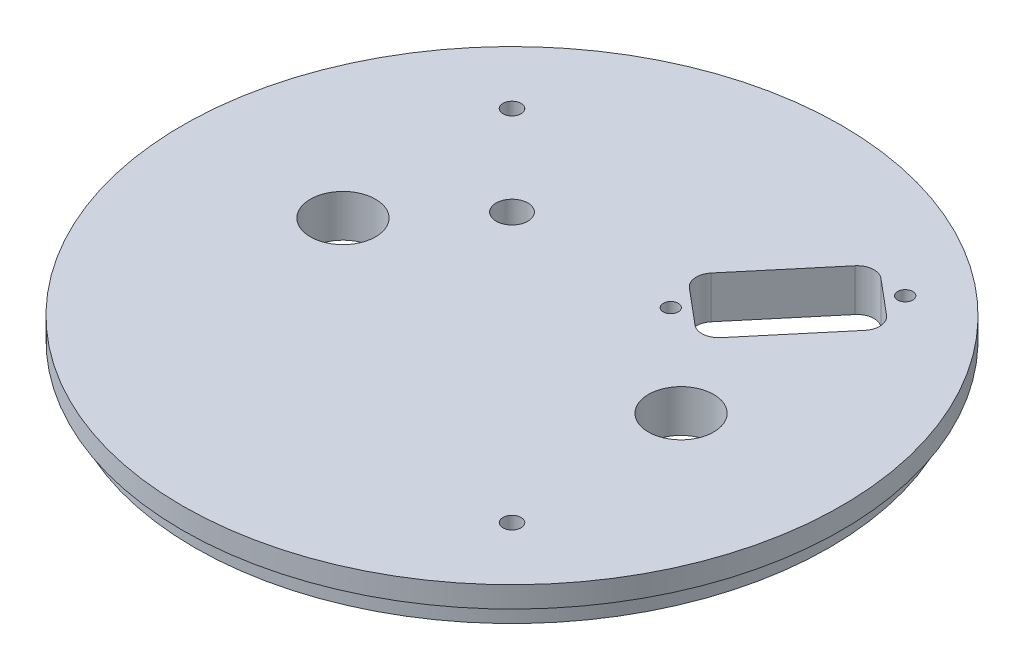
from build123d import *

# Parameters (mm, degrees)
SKETCH1_R                 = 49.5173
SKETCH1_R_2               = 4.9022
SKETCH1_R_3               = 1.3589
SKETCH1_R_4               = 2.38125
BOSS_EXTRUDE1_DEPTH       = 6.35
SKETCH2_R                 = 49.5173
SKETCH2_R_2               = 47.6885
CUT_EXTRUDE1_DEPTH        = 3.175
CUT_EXTRUDE2_START        = -5.969
CUT_EXTRUDE2_DEPTH        = 3.556
TAP_DRILL_FOR_4_40_TAP1_D = 2.2606
CUT_EXTRUDE3_DEPTH        = 71.315350377


with BuildPart() as part:
    # Sketch1 → Boss-Extrude1 (new body)
    with BuildSketch(Plane(origin=(0, 0, 0), x_dir=(1, 0, 0), z_dir=(0, 1, 0))):
        Circle(SKETCH1_R)
        with Locations((25.4, 0)):
            Circle(SKETCH1_R_2, mode=Mode.SUBTRACT)
        with Locations((-25.4, 0)):
            Circle(SKETCH1_R_2, mode=Mode.SUBTRACT)
        with Locations((-26.940768363, 26.940768363)):
            Circle(SKETCH1_R_3, mode=Mode.SUBTRACT)
        with Locations((26.940768363, -26.940768363)):
            Circle(SKETCH1_R_3, mode=Mode.SUBTRACT)
        with Locations((-13.470384182, 13.470384182)):
            Circle(SKETCH1_R_4, mode=Mode.SUBTRACT)
    extrude(amount=BOSS_EXTRUDE1_DEPTH)

    # Sketch2 → Cut-Extrude1 (cut)
    with BuildSketch(Plane.XZ):
        Circle(SKETCH2_R)
        Circle(SKETCH2_R_2, mode=Mode.SUBTRACT)
    extrude(amount=-CUT_EXTRUDE1_DEPTH, mode=Mode.SUBTRACT)

    # Sketch3 → Cut-Extrude2 (cut)
    with BuildSketch(Plane(origin=(0, 6.35, 0), x_dir=(1, 0, 0), z_dir=(0, 1, 0)).offset(CUT_EXTRUDE2_START)):
        with BuildLine():
            Line((3.2385, 34.925), (3.2385, 13.335))
            ThreePointArc((3.2385, 13.335), (0, 10.0965), (-3.2385, 13.335))
            Line((-3.2385, 13.335), (-3.2385, 34.925))
            ThreePointArc((-3.2385, 34.925), (0, 38.1635), (3.2385, 34.925))
        make_face()
        with BuildLine():
            Line((3.2385, -34.925), (3.2385, -13.335))
            ThreePointArc((3.2385, -13.335), (0, -10.0965), (-3.2385, -13.335))
            Line((-3.2385, -13.335), (-3.2385, -34.925))
            ThreePointArc((-3.2385, -34.925), (0, -38.1635), (3.2385, -34.925))
        make_face()
    extrude(amount=-CUT_EXTRUDE2_DEPTH, mode=Mode.SUBTRACT)

    # Tap Drill for #4-40 Tap1 (through all)
    with Locations(Plane(origin=(0, 6.35, 0), x_dir=(1, 0, 0), z_dir=(0, 1, 0))):
        with Locations((10.884536857, 12.971685903), (26.954227124, 32.122797011)):
            Hole(TAP_DRILL_FOR_4_40_TAP1_D / 2)

    # Sketch4 → Cut-Extrude3 (cut, through all)
    with BuildSketch(Plane(origin=(0, 6.35, 0), x_dir=(1, 0, 0), z_dir=(0, 1, 0))):
        with BuildLine():
            Line((9.727182938, 16.926982214), (14.980715729, 12.518744787))
            ThreePointArc((14.980715729, 12.518744787), (16.834771844, 11.934163139), (18.559149143, 12.831817144))
            Line((18.559149143, 12.831817144), (28.424653401, 24.589067286))
            ThreePointArc((28.424653401, 24.589067286), (29.009235048, 26.443123401), (28.111581044, 28.1675007))
            Line((28.111581044, 28.1675007), (22.858048253, 32.575738127))
            ThreePointArc((22.858048253, 32.575738127), (21.003992138, 33.160319775), (19.279614839, 32.26266577))
            Line((19.279614839, 32.26266577), (9.414110581, 20.505415628))
            ThreePointArc((9.414110581, 20.505415628), (8.829528933, 18.651359513), (9.727182938, 16.926982214))
        make_face()
    extrude(amount=-CUT_EXTRUDE3_DEPTH, mode=Mode.SUBTRACT)


solid = part.part
